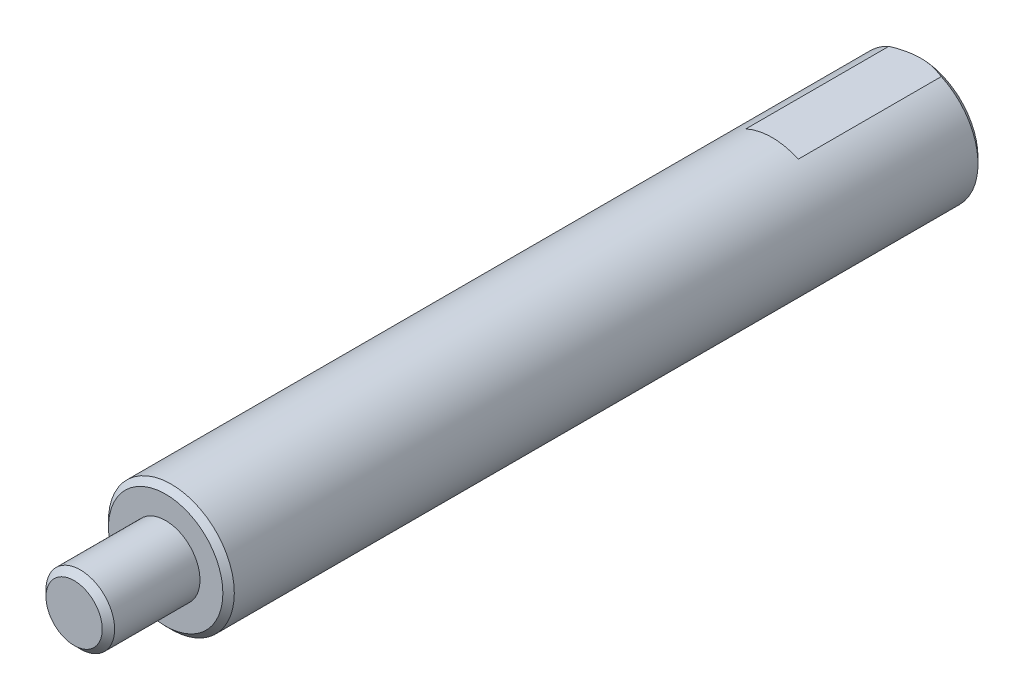
from build123d import *

# Parameters (mm, degrees)
SKETCH_1_R             = 5.5
EXTRUDE_1_DEPTH        = 66
CHAMFER_1_SIZE         = 0.5
SKETCH_2_R             = 3.3
EXTRUDE_2_DEPTH        = 8
HOLE_WIZARD_M5_1_D     = 4.2
HOLE_WIZARD_M5_1_DEPTH = 12.4
HOLE_WIZARD_M5_1_TIP   = 1.2618073
CHAMFER_3_SIZE         = 0.5
SKETCH_6_W             = 10
SKETCH_6_H             = 3
CUT_EXTRUDE_1_DEPTH    = 13


# Read off the part's stored shape, not the designer's step: M6 机械螺纹 螺柱1
with BuildPart() as part:
    # 草图1 → 拉伸1 (new body)
    with BuildSketch(Plane.XY):
        Circle(SKETCH_1_R)
    extrude(amount=EXTRUDE_1_DEPTH)

    # 倒角1
    chamfer_1_edges = [part.edges().sort_by_distance(p)[0] for p in [
        (-5.5, 0, 0),
        (-5.5, 0, 66),
    ]]
    chamfer(chamfer_1_edges, length=CHAMFER_1_SIZE)

    # 草图2 → 拉伸2 (add)
    with BuildSketch(Plane.XY.offset(66)):
        Circle(SKETCH_2_R)
    extrude(amount=EXTRUDE_2_DEPTH)

    # M5 螺纹孔1
    with Locations(Plane(origin=(0, 0, 0), x_dir=(-1, 0, 0), z_dir=(0, 0, -1))):
        with Locations((0, 0)):
            Hole(HOLE_WIZARD_M5_1_D / 2, depth=HOLE_WIZARD_M5_1_DEPTH)
            with Locations((0, 0, -(HOLE_WIZARD_M5_1_DEPTH + HOLE_WIZARD_M5_1_TIP / 2))):  # 118° drill point
                Cone(0, HOLE_WIZARD_M5_1_D / 2, HOLE_WIZARD_M5_1_TIP, mode=Mode.SUBTRACT)

    # 倒角3
    chamfer_3_edges = [part.edges().sort_by_distance(p)[0] for p in [
        (-2.1, 0, 0),
    ]]
    chamfer(chamfer_3_edges, length=CHAMFER_3_SIZE)

    # 草图6 → 切除-拉伸1 (cut)
    with BuildSketch(Plane(origin=(0, 0, 0), x_dir=(-1, 0, 0), z_dir=(0, 0, -1))):
        with Locations((0, 6.5)):
            Rectangle(SKETCH_6_W, SKETCH_6_H)
        with Locations((0, -6.5)):
            Rectangle(SKETCH_6_W, SKETCH_6_H)
    extrude(amount=-CUT_EXTRUDE_1_DEPTH, mode=Mode.SUBTRACT)

    # M6 机械螺纹 螺柱1 outline → M6 机械螺纹 螺柱1 (revolve, cut)
    with BuildSketch(Plane.XZ):
        Polygon((3.3, 74), (2.4585, 74), (3, 73.4585), (3, 66), (3.3, 66), align=None)
    revolve(axis=Axis((0, 0, 0), (0, 0, 1)), mode=Mode.SUBTRACT)


solid = part.part
